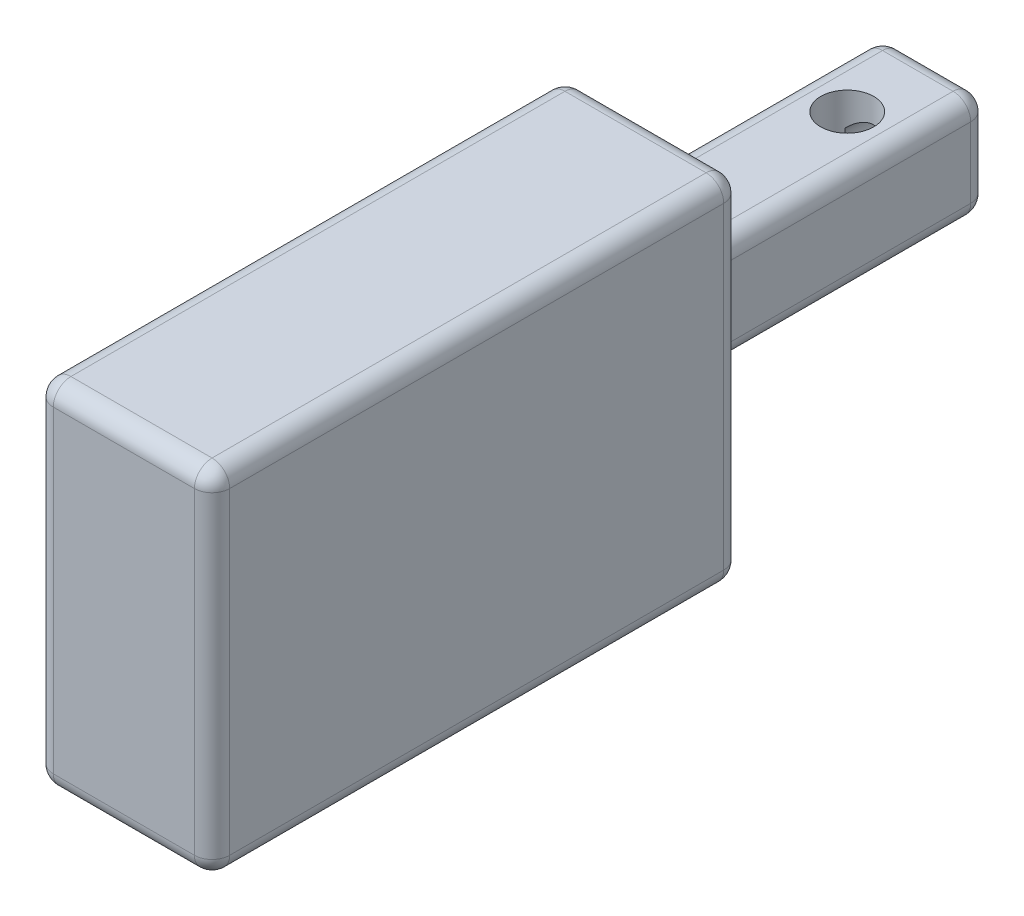
from build123d import *

# Parameters (mm, degrees)
SKETCH_1_W          = 10
SKETCH_1_H          = 22
EXTRUDE_1_DEPTH     = 30
SKETCH_2_W          = 6
SKETCH_2_H          = 6
EXTRUDE_3_DEPTH     = 14
SKETCH_3_R          = 1.5
CUT_EXTRUDE_1_DEPTH = 6
SKETCH_6_W          = 10
SKETCH_6_H          = 30
CUT_EXTRUDE_2_DEPTH = 2
SKETCH_7_W          = 6
SKETCH_7_H          = 6
EXTRUDE_4_DEPTH     = 2
FILLET_1_R          = 1
SKETCH_8_R          = 1.6
CUT_EXTRUDE_3_DEPTH = 4


with BuildPart() as part:
    # 草图1 → 凸台-拉伸1 (new body)
    with BuildSketch(Plane.XY):
        with Locations((5, 11)):
            Rectangle(SKETCH_1_W, SKETCH_1_H)
    extrude(amount=EXTRUDE_1_DEPTH)

    # 草图2 → 凸台-拉伸3 (add)
    with BuildSketch(Plane.XY):
        with Locations((5, 12)):
            Rectangle(SKETCH_2_W, SKETCH_2_H)
    extrude(amount=-EXTRUDE_3_DEPTH)

    # 草图3 → 切除-拉伸1 (cut)
    with BuildSketch(Plane(origin=(0, 9, 0), x_dir=(-1, 0, 0), z_dir=(0, -1, 0))):
        with Locations(Location((-5, 11, 0), (0, 0, 90))):
            Circle(SKETCH_3_R)
    extrude(amount=-CUT_EXTRUDE_1_DEPTH, mode=Mode.SUBTRACT)

    # 草图6 → 切除-拉伸2 (cut)
    with BuildSketch(Plane(origin=(0, 22, 0), x_dir=(1, 0, 0), z_dir=(0, 1, 0))):
        with Locations((5, -15)):
            Rectangle(SKETCH_6_W, SKETCH_6_H)
    extrude(amount=-CUT_EXTRUDE_2_DEPTH, mode=Mode.SUBTRACT)

    # 草图7 → 凸台-拉伸4 (add)
    with BuildSketch(Plane(origin=(0, 0, -14), x_dir=(-1, 0, 0), z_dir=(0, 0, -1))):
        with Locations((-5, 12)):
            Rectangle(SKETCH_7_W, SKETCH_7_H)
    extrude(amount=EXTRUDE_4_DEPTH)

    # 圆角1
    fillet_1_edges = [part.edges().sort_by_distance(p)[0] for p in [
        (10, 10, 30),
        (2, 9, -8),
        (2, 15, -8),
        (8, 15, -8),
        (8, 9, -8),
        (2, 12, 0),
        (5, 9, 0),
        (8, 12, 0),
        (5, 15, 0),
        (0, 10, 30),
        (0, 10, 0),
        (0, 20, 15),
        (5, 20, 0),
        (10, 20, 15),
        (5, 20, 30),
        (2, 12, -16),
        (5, 15, -16),
        (8, 12, -16),
        (5, 9, -16),
        (10, 10, 0),
        (5, 0, 0),
        (10, 0, 15),
        (0, 0, 15),
        (5, 0, 30),
    ]]
    fillet(fillet_1_edges, radius=FILLET_1_R - 0.0001)  # a hair under: the kernel refuses the full size

    # 草图8 → 切除-拉伸3 (cut)
    with BuildSketch(Plane(origin=(0, 0, -16), x_dir=(-1, 0, 0), z_dir=(0, 0, -1))):
        with Locations((-5, 12)):
            Circle(SKETCH_8_R)
    extrude(amount=-CUT_EXTRUDE_3_DEPTH, mode=Mode.SUBTRACT)


solid = part.part
